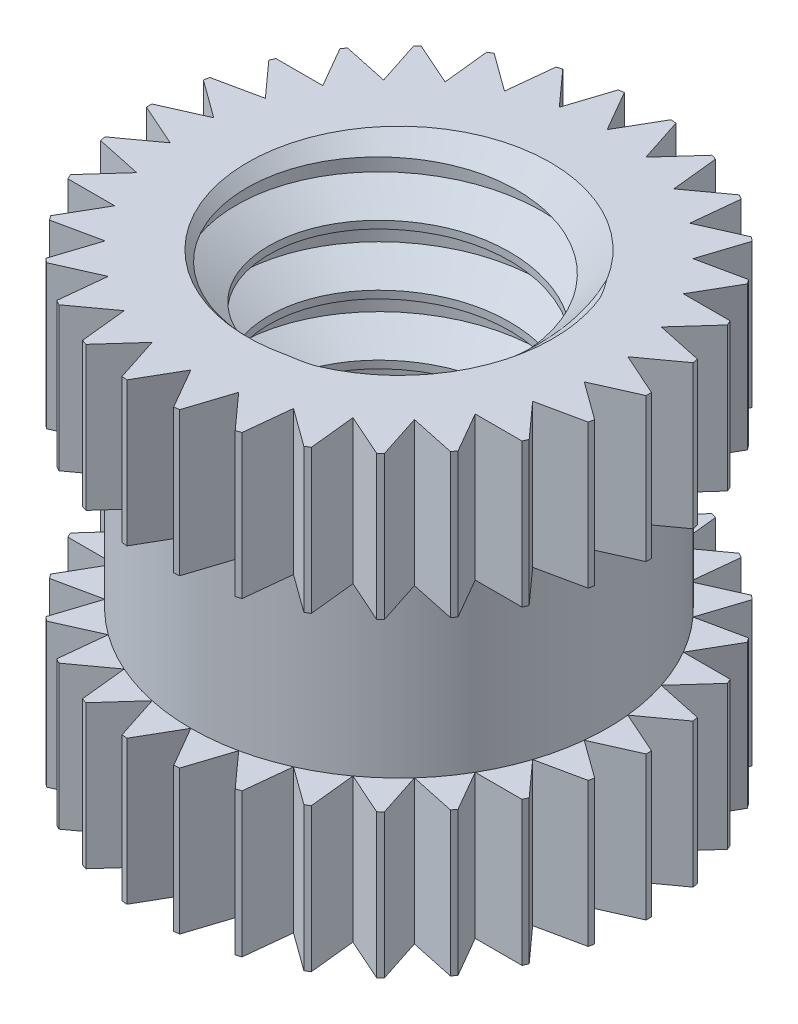
from build123d import *

# Parameters (mm, degrees)
ENL_V_MAT_EXTRU_1_REACH      = 5.801
R_P_TITION_CIRCULAIRE1_COUNT = 30
CHANFREIN1_SIZE              = 0.2
FILETAGE1_PITCH              = 0.4


with BuildPart() as part:
    # Esquisse1 → Révolution1 (revolve)
    with BuildSketch(Plane.XY, mode=Mode.PRIVATE) as r_volution1_sk:
        Polygon((0.8, 0), (0.8, 3), (1.65, 3), (1.65, 2.05), (1.375, 2.05), (1.375, 0.95), (1.65, 0.95), (1.65, 0), align=None)
    revolve(r_volution1_sk.sketch.rotate(Axis((0, 0, 0), (0, 1, 0)), 90), axis=Axis((0, 0, 0), (0, 1, 0)))

    # Enlèv. mat.-Extru.1: up to this face of the body (flat: up to its plane)
    enl_v_mat_extru_1_end = Plane(part.part.faces().sort_by_distance((0, 0, 1.603330952))[0])
    # Esquisse2 → Enlèv. mat.-Extru.1 (cut, up to the picked face)
    with BuildSketch(Plane(origin=(0, 3, 0), x_dir=(1, 0, 0), z_dir=(0, 1, 0)), mode=Mode.PRIVATE) as enl_v_mat_extru_1_sk1:
        Polygon((-0.25, 1.808012702), (0, 1.375), (0.25, 1.808012702), align=None)
    enl_v_mat_extru_1_tool1 = split(extrude(enl_v_mat_extru_1_sk1.sketch, amount=-ENL_V_MAT_EXTRU_1_REACH, mode=Mode.PRIVATE), bisect_by=enl_v_mat_extru_1_end, keep=Keep.BOTH, mode=Mode.PRIVATE)
    enl_v_mat_extru_1 = enl_v_mat_extru_1_tool1.solids().sort_by(Axis((0, 3, -1.663675), (0, -1, 0)))[0]
    add(enl_v_mat_extru_1, mode=Mode.SUBTRACT)

    # Répétition circulaire1: Enlèv. mat.-Extru.1 ×30 about axis
    r_p_tition_circulaire1_axis = Axis((0, 0, 0), (0, 1, 0))
    for i in range(1, R_P_TITION_CIRCULAIRE1_COUNT):
        add(enl_v_mat_extru_1.rotate(r_p_tition_circulaire1_axis, i * 360 / R_P_TITION_CIRCULAIRE1_COUNT), mode=Mode.SUBTRACT)

    # Chanfrein1
    chanfrein1_edges = [part.edges().sort_by_distance(p)[0] for p in [
        (0, 0, 0.8),
        (0, 3, 0.8),
    ]]
    chamfer(chanfrein1_edges, length=CHANFREIN1_SIZE)

    # Filetage1: the profile of Profil de filetage1 profile screwed along a right-hand helix of 9.5 turns, 6 arcs to a turn; built about Z, then put on its axis
    filetage1_z = Axis((0, 0, 0), (0, 0, 1))
    filetage1_corners = [(0.7997, 0, -0.000173205), (0.7997, 0, 0.350173204), (1.01650635, 0, 0.224999999), (1.01650635, 0, 0.124999999)]
    with BuildLine(mode=Mode.PRIVATE) as filetage1_profile:
        Line(filetage1_corners[0], filetage1_corners[1])
        Line(filetage1_corners[1], filetage1_corners[2])
        Line(filetage1_corners[2], filetage1_corners[3])
        Line(filetage1_corners[3], filetage1_corners[0])
    filetage1_cap = Face(filetage1_profile.wire())
    filetage1_turn_angles = [0, 30, 60, 90, 120, 150, 180, 210, 240, 270, 300, 330, 360]
    filetage1_turn_weights = [1, 0.8660254037844387, 1, 0.8660254037844387, 1, 0.8660254037844387, 1, 0.8660254037844387, 1, 0.8660254037844387, 1, 0.8660254037844387, 1]
    filetage1_turn_rails = [Edge.make_bspline([Vector(p[0], p[1], 0).rotate(filetage1_z, filetage1_turn_angles[k]) / filetage1_turn_weights[k] + Vector(0, 0, p[2] + FILETAGE1_PITCH * filetage1_turn_angles[k] / 360) for k in range(13)], [0, 0, 0, 1, 1, 2, 2, 3, 3, 4, 4, 5, 5, 6, 6, 6], 2, filetage1_turn_weights) for p in filetage1_corners]
    filetage1_turn_sides = [Face.make_surface_from_curves(filetage1_turn_rails[p[0]], filetage1_turn_rails[p[1]]) for p in [(0, 1), (1, 2), (2, 3), (3, 0)]]
    filetage1_last_angles = [3240, 3270, 3300, 3330, 3360, 3390, 3420]
    filetage1_last_weights = [1, 0.8660254037844387, 1, 0.8660254037844387, 1, 0.8660254037844446, 1]
    filetage1_last_rails = [Edge.make_bspline([Vector(p[0], p[1], 0).rotate(filetage1_z, filetage1_last_angles[k]) / filetage1_last_weights[k] + Vector(0, 0, p[2] + FILETAGE1_PITCH * filetage1_last_angles[k] / 360) for k in range(7)], [0, 0, 0, 1, 1, 2, 2, 3, 3, 3], 2, filetage1_last_weights) for p in filetage1_corners]
    filetage1_last_sides = [Face.make_surface_from_curves(filetage1_last_rails[p[0]], filetage1_last_rails[p[1]]) for p in [(0, 1), (1, 2), (2, 3), (3, 0)]]
    filetage1 = Plane(origin=(0, 3.8, 0), x_dir=(-1, 0, 0), z_dir=(0, -1, 0)) * Solid(Shell([*[p.moved(Location((0, 0, FILETAGE1_PITCH * i))) for i in range(9) for p in filetage1_turn_sides], *filetage1_last_sides, filetage1_cap, filetage1_cap.rotate(filetage1_z, 3420).moved(Location((0, 0, FILETAGE1_PITCH * 3420 / 360)))]))
    add(filetage1, mode=Mode.SUBTRACT)


solid = part.part
